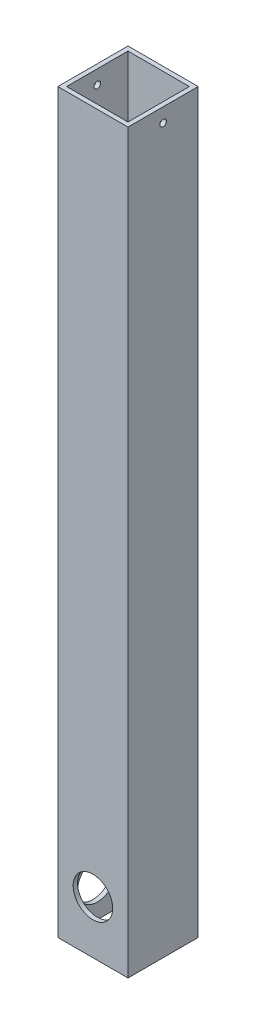
from build123d import *

# Parameters (mm, degrees)
SKETCH1_W           = 50.8
SKETCH1_H           = 50.8
SKETCH1_W_2         = 44.45
SKETCH1_H_2         = 44.45
BOSS_EXTRUDE1_DEPTH = 533.4
SKETCH2_R           = 14.2875
CUT_EXTRUDE1_DEPTH  = 3.175
SKETCH3_R           = 14.3002
CUT_EXTRUDE2_DEPTH  = 537.415286881
SKETCH4_R           = 2.38125
CUT_EXTRUDE3_DEPTH  = 537.415286881


with BuildPart() as part:
    # Sketch1 → Boss-Extrude1 (new body)
    with BuildSketch(Plane(origin=(0, 0, 0), x_dir=(1, 0, 0), z_dir=(0, 1, 0))):
        Rectangle(SKETCH1_W, SKETCH1_H)
        Rectangle(SKETCH1_W_2, SKETCH1_H_2, mode=Mode.SUBTRACT)
    extrude(amount=BOSS_EXTRUDE1_DEPTH)

    # Sketch2 → Cut-Extrude1 (cut)
    with BuildSketch(Plane.ZY.offset(25.4)):
        with Locations((0, 25.4)):
            Circle(SKETCH2_R)
    extrude(amount=-CUT_EXTRUDE1_DEPTH, mode=Mode.SUBTRACT)

    # Sketch3 → Cut-Extrude2 (cut, through all)
    with BuildSketch(Plane(origin=(0, 0, -25.4), x_dir=(-1, 0, 0), z_dir=(0, 0, -1))):
        with Locations((0, 38.1)):
            Circle(SKETCH3_R)
    extrude(amount=-CUT_EXTRUDE2_DEPTH, mode=Mode.SUBTRACT)

    # Sketch4 → Cut-Extrude3 (cut, through all)
    with BuildSketch(Plane.ZY.offset(25.4)):
        with Locations((0, 523.24)):
            Circle(SKETCH4_R)
    extrude(amount=-CUT_EXTRUDE3_DEPTH, mode=Mode.SUBTRACT)


solid = part.part
